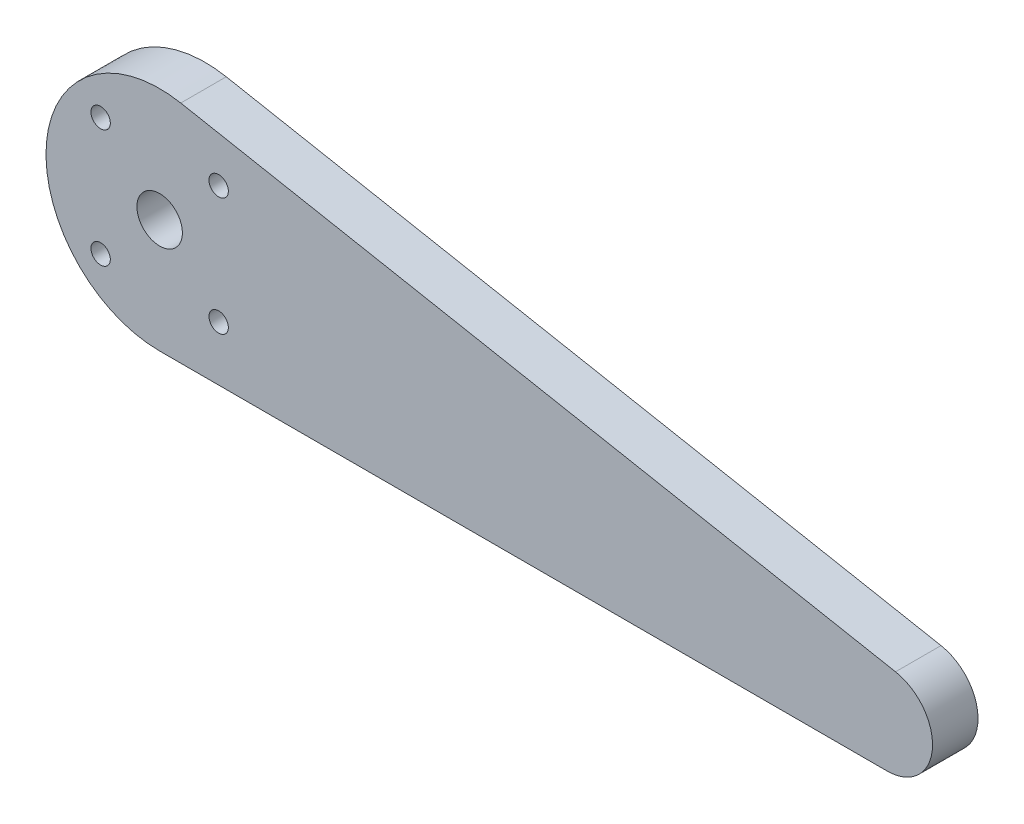
from build123d import *
from build123d.topology import SkipClean

# Parameters (mm, degrees)
SKETCH1_R             = 3.175
BOSS_EXTRUDE1_DEPTH   = 6.35
F_6_32_TAPPED_HOLE1_D = 2.7051
BOSS_EXTRUDE3_START   = 1.5875
SKETCH5_R             = 7
SKETCH5_R_2           = 3.175
BOSS_EXTRUDE3_DEPTH   = 1.5875


with BuildPart() as part:
    # Sketch1 → Boss-Extrude1 (new body)
    with BuildSketch(Plane.XY):
        with BuildLine():
            Line((0, -15.875), (101.6, -15.875))
            ThreePointArc((101.6, -15.875), (107.922277335, -10.1177135), (102.780251694, -3.285648596))
            Line((102.780251694, -3.285648596), (2.950629235, 15.598378509))
            ThreePointArc((2.950629235, 15.598378509), (-15.805693339, 1.481783751), (0, -15.875))
        make_face()
        Circle(SKETCH1_R, mode=Mode.SUBTRACT)
    extrude(amount=BOSS_EXTRUDE1_DEPTH)

    # #6-32 Tapped Hole1 (through all)
    with Locations(Plane.XY.offset(6.35)):
        with Locations((8.242390195, 8.242390195), (-8.242390195, 8.242390195), (8.242390195, -8.242390195), (-8.242390195, -8.242390195)):
            Hole(F_6_32_TAPPED_HOLE1_D / 2)

    # Sketch5 → Boss-Extrude3 (add)
    with SkipClean():  # the faces are left unmerged after this step: merging them gives an invalid solid
        with BuildSketch(Plane(origin=(0, 0, 0), x_dir=(-1, 0, 0), z_dir=(0, 0, -1)).offset(BOSS_EXTRUDE3_START)):
            Circle(SKETCH5_R)
            Circle(SKETCH5_R_2, mode=Mode.SUBTRACT)
        extrude(amount=-BOSS_EXTRUDE3_DEPTH)


solid = part.part
